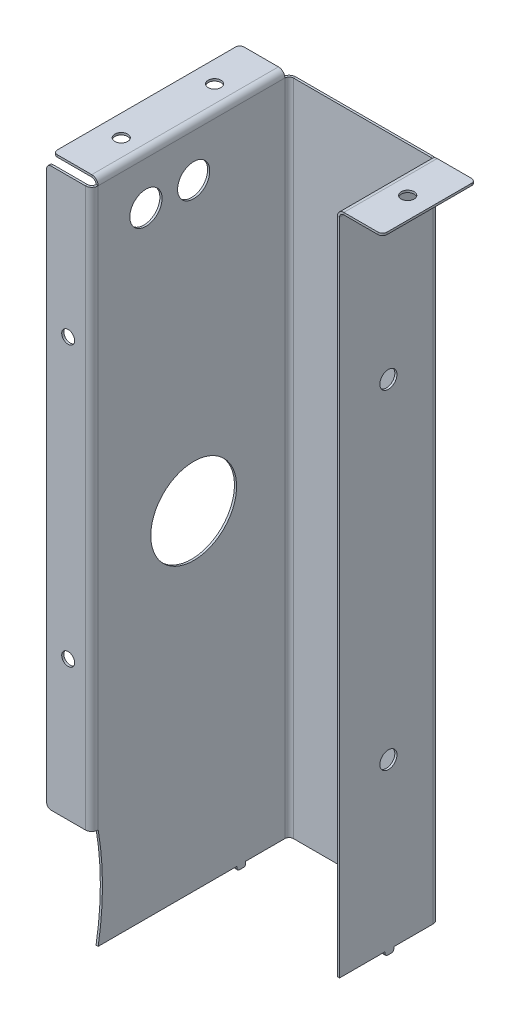
from build123d import *

# Parameters (mm, degrees)
SKETCH1_W                = 64
SKETCH1_H                = 307
SKETCH1_R                = 3
BOSS_EXTRUDE1_DEPTH      = 1
EDGE_FLANGE1_DEPTH       = 307
EDGE_FLANGE1_START       = 1
EDGE_FLANGE1_PROFILE_R   = 7.5
EDGE_FLANGE1_PROFILE_R_2 = 20
EDGE_FLANGE1_FLAT_DEPTH  = 1
EDGE_FLANGE2_DEPTH       = 260
EDGE_FLANGE2_START       = -1
EDGE_FLANGE2_PROFILE_R   = 3
EDGE_FLANGE2_FLAT_DEPTH  = 1
EDGE_FLANGE3_DEPTH       = 87
EDGE_FLANGE3_START       = -1
EDGE_FLANGE3_PROFILE_R   = 3
EDGE_FLANGE3_FLAT_DEPTH  = 1
EDGE_FLANGE4_DEPTH       = 307
EDGE_FLANGE4_START       = 1
EDGE_FLANGE4_PROFILE_R   = 4
EDGE_FLANGE4_FLAT_DEPTH  = 1
EDGE_FLANGE5_DEPTH       = 43.5
EDGE_FLANGE5_START       = 1
EDGE_FLANGE5_PROFILE_R   = 3
EDGE_FLANGE5_FLAT_DEPTH  = 1


# Sheet-metal steps are written as plain solids
with BuildPart() as part:
    # Sketch1 → Boss-Extrude1 (new body)
    with BuildSketch(Plane.XY):
        Rectangle(SKETCH1_W, SKETCH1_H)
        Circle(SKETCH1_R, mode=Mode.SUBTRACT)
        with Locations((0, 76.75)):
            Circle(SKETCH1_R, mode=Mode.SUBTRACT)
        with Locations((0, -76.75)):
            Circle(SKETCH1_R, mode=Mode.SUBTRACT)
    extrude(amount=BOSS_EXTRUDE1_DEPTH)

    # Edge-Flange1 bend section (across the edge) → Edge-Flange1 (add)
    with BuildSketch(Plane(origin=(-34, 153.5, 1), x_dir=(1, 0, 0), z_dir=(0, -1, 0))):
        with BuildLine():
            Line((-1, 2), (0, 2))
            ThreePointArc((0, 2), (0.585786438, 0.585786438), (2, 0))
            Line((2, 0), (2, -1))
            ThreePointArc((2, -1), (-0.121320344, -0.121320344), (-1, 2))
        make_face()
    extrude(amount=EDGE_FLANGE1_DEPTH)

    # Edge-Flange1 profile (on flange) → Edge-Flange1 flat (add)
    with BuildSketch(Plane(origin=(-34, 0, 1), x_dir=(0, -1, 0), z_dir=(-1, 0, 0)).offset(EDGE_FLANGE1_START)):
        with BuildLine():
            Line((-153.5, 89), (-153.5, 2))
            Line((-153.5, 2), (153.5, 2))
            Line((153.5, 2), (153.5, 20.25))
            Line((153.5, 20.25), (154.5, 20.25))
            ThreePointArc((154.5, 20.25), (155.207106781, 20.542893219), (155.5, 21.25))
            Line((155.5, 21.25), (155.5, 23.25))
            ThreePointArc((155.5, 23.25), (155.207106781, 23.957106781), (154.5, 24.25))
            Line((154.5, 24.25), (153.5, 24.25))
            Line((153.5, 24.25), (153.5, 89))
            ThreePointArc((153.5, 89), (130, 87), (106.5, 89))
            Line((106.5, 89), (-153.5, 89))
        make_face()
        with Locations((-133.5, 44.5)):
            Circle(EDGE_FLANGE1_PROFILE_R, mode=Mode.SUBTRACT)
        with Locations((0, 44.5)):
            Circle(EDGE_FLANGE1_PROFILE_R_2, mode=Mode.SUBTRACT)
        with Locations((-133.5, 66.75)):
            Circle(EDGE_FLANGE1_PROFILE_R, mode=Mode.SUBTRACT)
    extrude(amount=-EDGE_FLANGE1_FLAT_DEPTH)

    # Edge-Flange2 bend section (across the edge) → Edge-Flange2 (add)
    with BuildSketch(Plane(origin=(-35, -106.5, 92), x_dir=(0, 0, -1), z_dir=(0, 1, 0))):
        with BuildLine():
            Line((-1, 2), (0, 2))
            ThreePointArc((0, 2), (0.585786438, 0.585786438), (2, 0))
            Line((2, 0), (2, -1))
            ThreePointArc((2, -1), (-0.121320344, -0.121320344), (-1, 2))
        make_face()
    extrude(amount=EDGE_FLANGE2_DEPTH)

    # Edge-Flange2 profile (on flange) → Edge-Flange2 flat (add)
    with BuildSketch(Plane(origin=(-35, 0, 92), x_dir=(0, -1, 0), z_dir=(0, 0, -1)).offset(EDGE_FLANGE2_START)):
        with BuildLine():
            Line((-153.5, 2), (106.5, 2))
            Line((106.5, 2), (106.5, 18))
            ThreePointArc((106.5, 18), (105.914213562, 19.414213562), (104.5, 20))
            Line((104.5, 20), (-151.5, 20))
            ThreePointArc((-151.5, 20), (-152.914213562, 19.414213562), (-153.5, 18))
            Line((-153.5, 18), (-153.5, 2))
        make_face()
        with Locations((41.5, 10)):
            Circle(EDGE_FLANGE2_PROFILE_R, mode=Mode.SUBTRACT)
        with Locations((-88.5, 10)):
            Circle(EDGE_FLANGE2_PROFILE_R, mode=Mode.SUBTRACT)
    extrude(amount=EDGE_FLANGE2_FLAT_DEPTH)

    # Edge-Flange3 bend section (across the edge) → Edge-Flange3 (add)
    with BuildSketch(Plane(origin=(-35, 155.5, 90), x_dir=(0, -1, 0), z_dir=(0, 0, -1))):
        with BuildLine():
            Line((-1, 2), (0, 2))
            ThreePointArc((0, 2), (0.585786438, 0.585786438), (2, 0))
            Line((2, 0), (2, -1))
            ThreePointArc((2, -1), (-0.121320344, -0.121320344), (-1, 2))
        make_face()
    extrude(amount=EDGE_FLANGE3_DEPTH)

    # Edge-Flange3 profile (on flange) → Edge-Flange3 flat (add)
    with BuildSketch(Plane(origin=(-35, 155.5, 0), x_dir=(0, 0, 1), z_dir=(0, -1, 0)).offset(EDGE_FLANGE3_START)):
        with BuildLine():
            Line((3, 2), (90, 2))
            Line((90, 2), (90, 18))
            ThreePointArc((90, 18), (89.414213562, 19.414213562), (88, 20))
            Line((88, 20), (5, 20))
            ThreePointArc((5, 20), (3.585786438, 19.414213562), (3, 18))
            Line((3, 18), (3, 2))
        make_face()
        with Locations((24.75, 10)):
            Circle(EDGE_FLANGE3_PROFILE_R, mode=Mode.SUBTRACT)
        with Locations((68.25, 10)):
            Circle(EDGE_FLANGE3_PROFILE_R, mode=Mode.SUBTRACT)
    extrude(amount=EDGE_FLANGE3_FLAT_DEPTH)

    # Edge-Flange4 bend section (across the edge) → Edge-Flange4 (add)
    with BuildSketch(Plane(origin=(34, -153.5, 1), x_dir=(-1, 0, 0), z_dir=(0, 1, 0))):
        with BuildLine():
            Line((-1, 2), (0, 2))
            ThreePointArc((0, 2), (0.585786438, 0.585786438), (2, 0))
            Line((2, 0), (2, -1))
            ThreePointArc((2, -1), (-0.121320344, -0.121320344), (-1, 2))
        make_face()
    extrude(amount=EDGE_FLANGE4_DEPTH)

    # Edge-Flange4 profile (on flange) → Edge-Flange4 flat (add)
    with BuildSketch(Plane(origin=(34, 0, 1), x_dir=(0, 1, 0), z_dir=(1, 0, 0)).offset(EDGE_FLANGE4_START)):
        with BuildLine():
            ThreePointArc((-155.5, 21.25), (-155.207106781, 20.542893219), (-154.5, 20.25))
            Line((-154.5, 20.25), (-153.5, 20.25))
            Line((-153.5, 20.25), (-153.5, 2))
            Line((-153.5, 2), (153.5, 2))
            Line((153.5, 2), (153.5, 45.5))
            Line((153.5, 45.5), (-153.5, 45.5))
            Line((-153.5, 45.5), (-153.5, 24.25))
            Line((-153.5, 24.25), (-154.5, 24.25))
            ThreePointArc((-154.5, 24.25), (-155.207106781, 23.957106781), (-155.5, 23.25))
            Line((-155.5, 23.25), (-155.5, 21.25))
        make_face()
        with Locations((-76.75, 22.75)):
            Circle(EDGE_FLANGE4_PROFILE_R, mode=Mode.SUBTRACT)
        with Locations((76.75, 22.75)):
            Circle(EDGE_FLANGE4_PROFILE_R, mode=Mode.SUBTRACT)
    extrude(amount=-EDGE_FLANGE4_FLAT_DEPTH)

    # Edge-Flange5 bend section (across the edge) → Edge-Flange5 (add)
    with BuildSketch(Plane(origin=(35, 155.5, 3), x_dir=(0, -1, 0), z_dir=(0, 0, 1))):
        with BuildLine():
            Line((-1, 2), (0, 2))
            ThreePointArc((0, 2), (0.585786438, 0.585786438), (2, 0))
            Line((2, 0), (2, -1))
            ThreePointArc((2, -1), (-0.121320344, -0.121320344), (-1, 2))
        make_face()
    extrude(amount=EDGE_FLANGE5_DEPTH)

    # Edge-Flange5 profile (on flange) → Edge-Flange5 flat (add)
    with BuildSketch(Plane(origin=(35, 155.5, 0), x_dir=(0, 0, 1), z_dir=(0, 1, 0)).offset(EDGE_FLANGE5_START)):
        with BuildLine():
            ThreePointArc((5, 20), (3.585786438, 19.414213562), (3, 18))
            Line((3, 18), (3, 2))
            Line((3, 2), (46.5, 2))
            Line((46.5, 2), (46.5, 18))
            ThreePointArc((46.5, 18), (45.914213562, 19.414213562), (44.5, 20))
            Line((44.5, 20), (5, 20))
        make_face()
        with Locations((24.75, 10)):
            Circle(EDGE_FLANGE5_PROFILE_R, mode=Mode.SUBTRACT)
    extrude(amount=-EDGE_FLANGE5_FLAT_DEPTH)


solid = part.part
